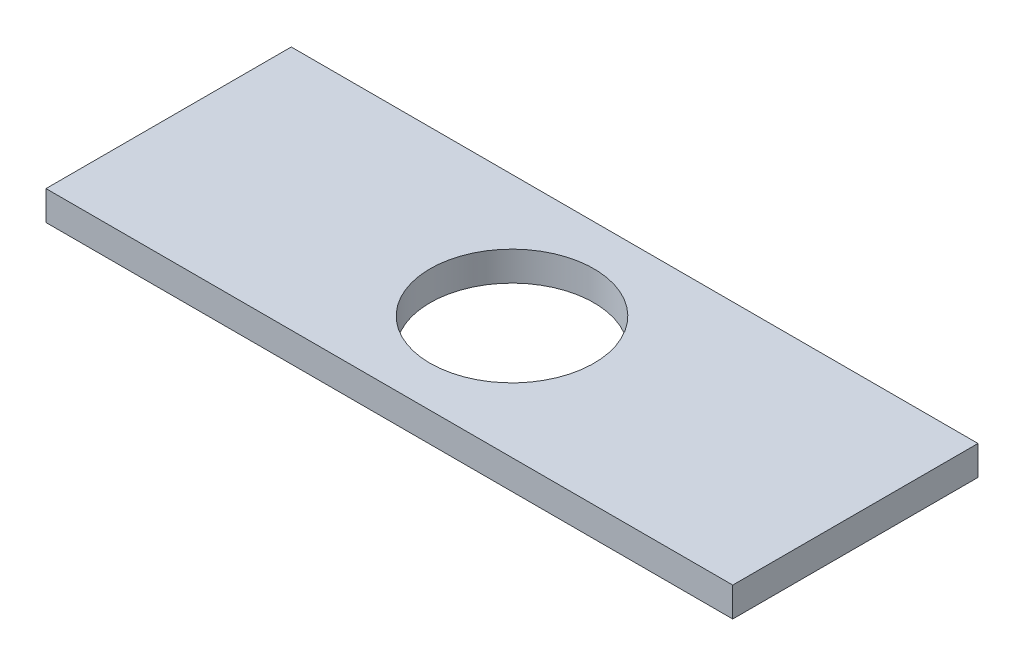
from build123d import *

# Parameters (mm, degrees)
SKETCH1_W      = 140
SKETCH1_H      = 50
SKETCH1_R      = 16.7
EXTRUDE1_DEPTH = 6


with BuildPart() as part:
    # Sketch1 → Extrude1 (new body)
    with BuildSketch(Plane(origin=(0, 0, 0), x_dir=(1, 0, 0), z_dir=(0, 1, 0))):
        Rectangle(SKETCH1_W, SKETCH1_H)
        Circle(SKETCH1_R, mode=Mode.SUBTRACT)
    extrude(amount=EXTRUDE1_DEPTH)


solid = part.part
